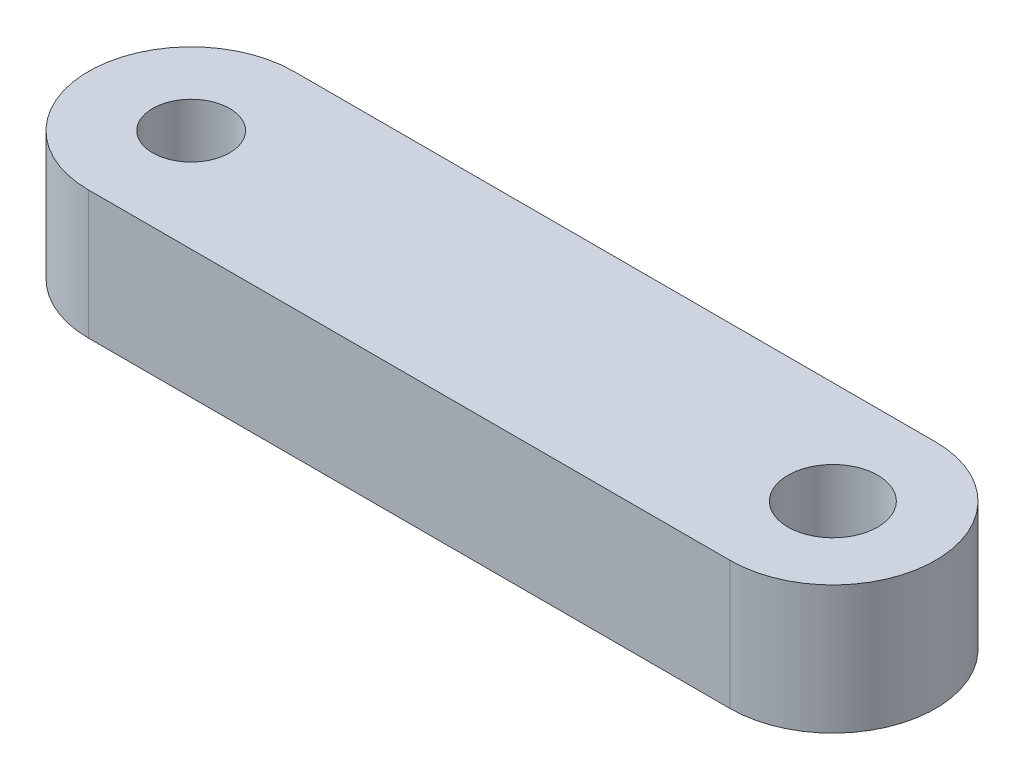
from build123d import *

# Parameters (mm, degrees)
CROQUIS1_R              = 3.5
CROQUIS1_R_2            = 3
SALIENTE_EXTRUIR1_DEPTH = 10


with BuildPart() as part:
    # Croquis1 → Saliente-Extruir1 (new body)
    with BuildSketch(Plane(origin=(0, 0, 0), x_dir=(1, 0, 0), z_dir=(0, 1, 0))):
        with BuildLine():
            Line((0, 8), (50, 8))
            ThreePointArc((50, 8), (58, 0), (50, -8))
            Line((50, -8), (0, -8))
            ThreePointArc((0, -8), (-8, 0), (0, 8))
        make_face()
        with Locations((50, 0)):
            Circle(CROQUIS1_R, mode=Mode.SUBTRACT)
        Circle(CROQUIS1_R_2, mode=Mode.SUBTRACT)
    extrude(amount=SALIENTE_EXTRUIR1_DEPTH)


solid = part.part
